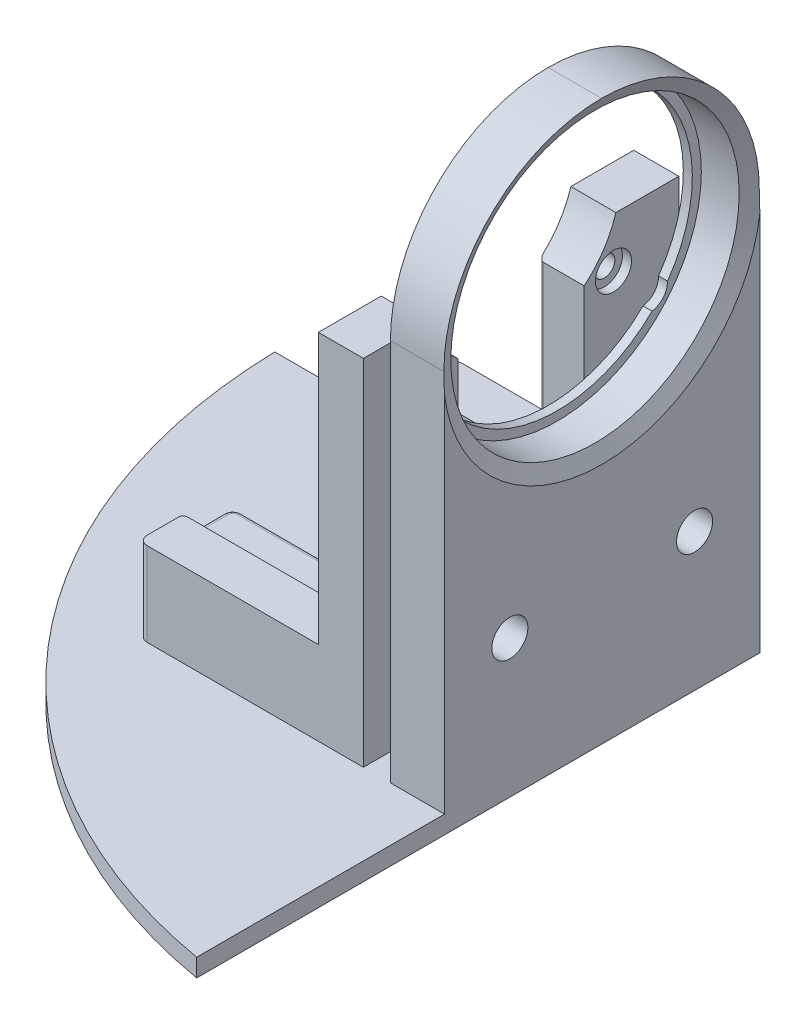
from build123d import *

# Parameters (mm, degrees)
EXTRUDE_1_DEPTH     = 2
SKETCH_2_W          = 6
SKETCH_2_H          = 35
EXTRUDE_2_DEPTH     = 60
FILLET_1_R          = 17.5
SKETCH_3_R          = 16
CUT_EXTRUDE_1_DEPTH = 5
CHAMFER_1_SIZE      = 1.640243073
CHAMFER_1_SIZE_2    = 0.8
SKETCH_4_R          = 15
CUT_EXTRUDE_2_DEPTH = 102.631713982
SKETCH_5_W          = 25
SKETCH_5_H          = 10.5
EXTRUDE_3_DEPTH     = 7.3
EXTRUDE_4_DEPTH     = 2
FILLET_2_R          = 1
EXTRUDE_5_DEPTH     = 5
SKETCH_9_R          = 1.15
CUT_EXTRUDE_3_DEPTH = 98.627174941
SKETCH_10_R         = 2
CUT_EXTRUDE_4_DEPTH = 10
FILLET_3_R          = 0.5


# Some blends are built 0.0001 mm under size
with BuildPart() as part:
    # 스케치1 → 보스-돌출1 (new body)
    with BuildSketch(Plane(origin=(0, 0, 0), x_dir=(1, 0, 0), z_dir=(0, 1, 0))):
        with BuildLine():
            Line((-11.151844037, -1.536211432), (-64.981844037, -1.536211432))
            ThreePointArc((-64.981844037, -1.536211432), (-49.250859027, -42.418779863), (-11.151844037, -64.036211432))
            Line((-11.151844037, -64.036211432), (-11.151844037, -1.536211432))
        make_face()
    extrude(amount=EXTRUDE_1_DEPTH)

    # 스케치2 → 보스-돌출2 (add)
    with BuildSketch(Plane(origin=(0, 2, 0), x_dir=(1, 0, 0), z_dir=(0, 1, 0))):
        with Locations((-14.151844037, -19.036211432)):
            Rectangle(SKETCH_2_W, SKETCH_2_H)
    extrude(amount=EXTRUDE_2_DEPTH)

    # 필렛1
    fillet_1_edges = [part.edges().sort_by_distance(p)[0] for p in [
        (-14.151844037, 62, 1.536211432),
        (-14.151844037, 62, 36.536211432),
    ]]
    fillet(fillet_1_edges, radius=FILLET_1_R - 0.0001)  # a hair under: the kernel refuses the full size

    # 스케치3 → 컷-돌출1 (cut)
    with BuildSketch(Plane(origin=(-11.151844037, 0, 0), x_dir=(0, 0, -1), z_dir=(1, 0, 0))):
        with Locations((-19.036211432, 44.5)):
            Circle(SKETCH_3_R)
    extrude(amount=-CUT_EXTRUDE_1_DEPTH, mode=Mode.SUBTRACT)

    # 모따기1
    # the kernel refuses this chamfer: 1.640243073, 0.8 mm, written as the material it takes off along each edge
    with BuildSketch(Plane(origin=(-11.151844037, 44.5, 19.036211432), x_dir=(0, 0, -1), z_dir=(0, -1, 0))) as chamfer_1_piece_1:
        Polygon((16 + CHAMFER_1_SIZE, 0), (16, -CHAMFER_1_SIZE_2), (16, 0), align=None)
    revolve(axis=Axis((-11.151844037, 44.5, 19.036211432), (1, 0, 0)), mode=Mode.SUBTRACT)

    # 스케치4 → 컷-돌출2 (cut, through all)
    with BuildSketch(Plane(origin=(-16.151844037, 0, 0), x_dir=(0, 0, -1), z_dir=(1, 0, 0))):
        with Locations((-19.036211432, 44.5)):
            Circle(SKETCH_4_R)
    extrude(amount=-CUT_EXTRUDE_2_DEPTH, mode=Mode.SUBTRACT)

    # 스케치5 → 보스-돌출3 (add)
    with BuildSketch(Plane(origin=(0, 2, 0), x_dir=(1, 0, 0), z_dir=(0, 1, 0))):
        with Locations((-32.651844037, -6.786211432)):
            Rectangle(SKETCH_5_W, SKETCH_5_H)
        with Locations((-32.651844037, -31.286211432)):
            Rectangle(SKETCH_5_W, SKETCH_5_H)
    extrude(amount=EXTRUDE_3_DEPTH)

    # 스케치6 → 보스-돌출4 (add)
    with BuildSketch(Plane(origin=(0, 9.3, 0), x_dir=(1, 0, 0), z_dir=(0, 1, 0))):
        Polygon((-45.151844037, -31.536211432), (-25.151844037, -31.536211432), (-25.151844037, -26.036211432), (-20.151844037, -26.036211432), (-20.151844037, -36.536211432), (-45.151844037, -36.536211432), align=None)
        Polygon((-45.151844037, -1.536211432), (-20.151844037, -1.536211432), (-20.151844037, -12.036211432), (-25.151844037, -12.036211432), (-25.151844037, -6.536211432), (-45.151844037, -6.536211432), align=None)
    extrude(amount=EXTRUDE_4_DEPTH)

    # 필렛2
    fillet_2_edges = [part.edges().sort_by_distance(p)[0] for p in [
        (-45.151844037, 6.65, 1.536211432),
        (-45.151844037, 5.65, 12.036211432),
        (-45.151844037, 5.65, 26.036211432),
        (-45.151844037, 6.65, 36.536211432),
    ]]
    fillet(fillet_2_edges, radius=FILLET_2_R)

    # 스케치7 → 보스-돌출5 (add)
    with BuildSketch(Plane.ZY.offset(25.151844037)):
        with BuildLine():
            Line((1.536211432, 11.3), (12.036211432, 11.3))
            Line((12.036211432, 11.3), (12.036211432, 36.014718626))
            ThreePointArc((12.036211432, 36.014718626), (9.884247068, 38.397414624), (8.511953739, 41.3))
            Line((8.511953739, 41.3), (1.536211432, 41.3))
            Line((1.536211432, 41.3), (1.536211432, 11.3))
        make_face()
        with BuildLine():
            Line((36.536211432, 11.3), (26.036211432, 11.3))
            Line((26.036211432, 11.3), (26.036211432, 36.014718626))
            ThreePointArc((26.036211432, 36.014718626), (28.188175797, 38.397414624), (29.560469126, 41.3))
            Line((29.560469126, 41.3), (36.536211432, 41.3))
            Line((36.536211432, 41.3), (36.536211432, 11.3))
        make_face()
    extrude(amount=-EXTRUDE_5_DEPTH)

    # 스케치9 → 컷-돌출3 (cut, through all)
    with BuildSketch(Plane.ZY.offset(25.151844037)):
        with Locations((8.786211432, 35.8)):
            Circle(SKETCH_9_R)
        with Locations((8.786211432, 15.3)):
            Circle(SKETCH_9_R)
        with Locations((29.286211432, 15.3)):
            Circle(SKETCH_9_R)
        with Locations((29.286211432, 35.8)):
            Circle(SKETCH_9_R)
    extrude(amount=-CUT_EXTRUDE_3_DEPTH, mode=Mode.SUBTRACT)

    # 스케치10 → 컷-돌출4 (cut)
    with BuildSketch(Plane(origin=(-11.151844037, 0, 0), x_dir=(0, 0, -1), z_dir=(1, 0, 0))):
        with Locations((-29.286211432, 15.3)):
            Circle(SKETCH_10_R)
        with Locations((-8.786211432, 15.3)):
            Circle(SKETCH_10_R)
        with Locations((-8.786211432, 35.8)):
            Circle(SKETCH_10_R)
        with Locations((-29.286211432, 35.8)):
            Circle(SKETCH_10_R)
    extrude(amount=-CUT_EXTRUDE_4_DEPTH, mode=Mode.SUBTRACT)

    # 필렛3
    fillet_3_edges = [part.edges().sort_by_distance(p)[0] for p in [
        (-45.151844037, 10.3, 31.536211432),
        (-25.151844037, 22.657359313, 26.036211432),
        (-35.151844037, 9.3, 31.536211432),
        (-45.151844037, 9.3, 29.286211432),
        (-44.858950818, 9.3, 26.329104651),
        (-34.651844037, 9.3, 12.036211432),
        (-44.858950818, 9.3, 11.743318213),
        (-45.151844037, 9.3, 8.786211432),
        (-35.151844037, 9.3, 6.536211432),
        (-45.151844037, 10.3, 6.536211432),
        (-25.151844037, 22.657359313, 12.036211432),
        (-34.651844037, 9.3, 26.036211432),
    ]]
    fillet(fillet_3_edges, radius=FILLET_3_R)


solid = part.part
